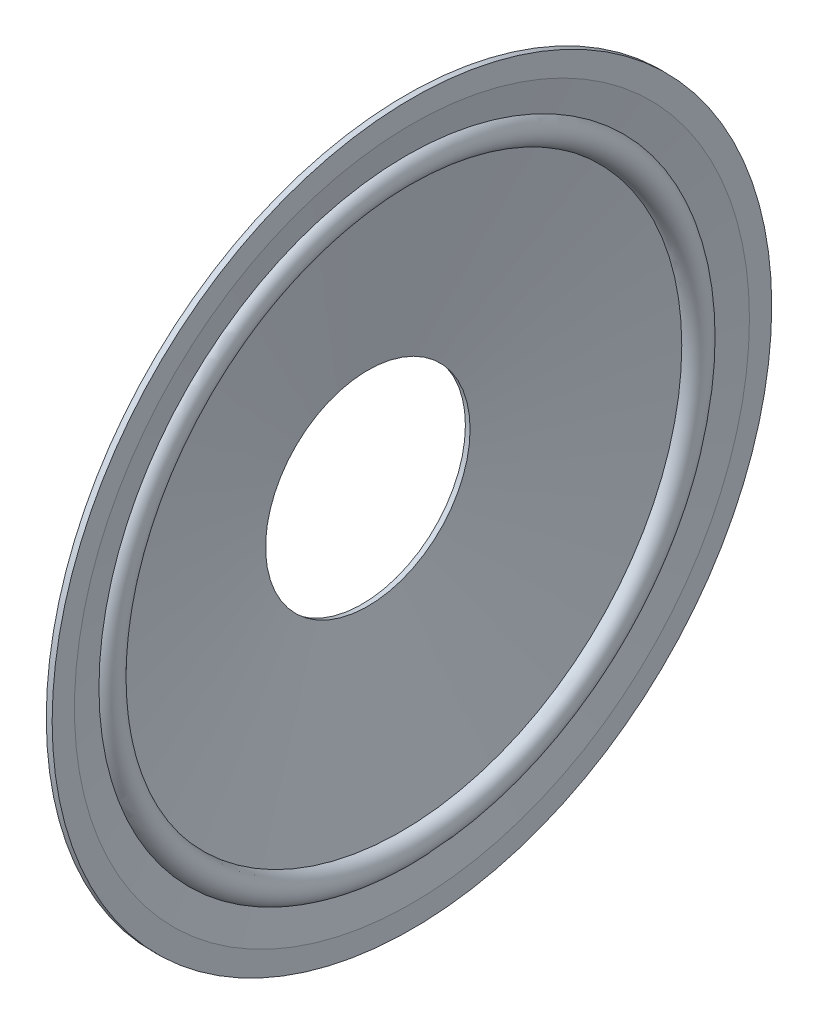
from build123d import *


with BuildPart() as part:
    # Thicken1: read off the stored shape, not the designer's step
    # Thicken1 outline → Thicken1 (revolve)
    with BuildSketch(Plane.YX):
        with BuildLine():
            Line((23.01858804, 2.8), (24.5, 2.8))
            Line((24.5, 2.8), (24.5, 3.2))
            Line((24.5, 3.2), (22.98141196, 3.2))
            Line((22.98141196, 3.2), (20.927327763, 2.814859213))
            ThreePointArc((20.927327763, 2.814859213), (19.876309331, 3.380862972), (19.101723702, 2.472558451))
            Line((19.101723702, 2.472558451), (6.963142293, 0.196574437))
            Line((6.963142293, 0.196574437), (7.036857707, -0.196574437))
            Line((7.036857707, -0.196574437), (19.175439116, 2.079409577))
            ThreePointArc((19.175439116, 2.079409577), (19.40608122, 2.213007878), (19.501580433, 2.461853586))
            ThreePointArc((19.501580433, 2.461853586), (19.950024745, 2.987714098), (20.5585091, 2.660027711))
            ThreePointArc((20.5585091, 2.660027711), (20.737669453, 2.462680671), (21.001043177, 2.421710338))
            Line((21.001043177, 2.421710338), (23.01858804, 2.8))
        make_face()
    revolve(axis=Axis((0, 0, 0), (1, 0, 0)))


solid = part.part
